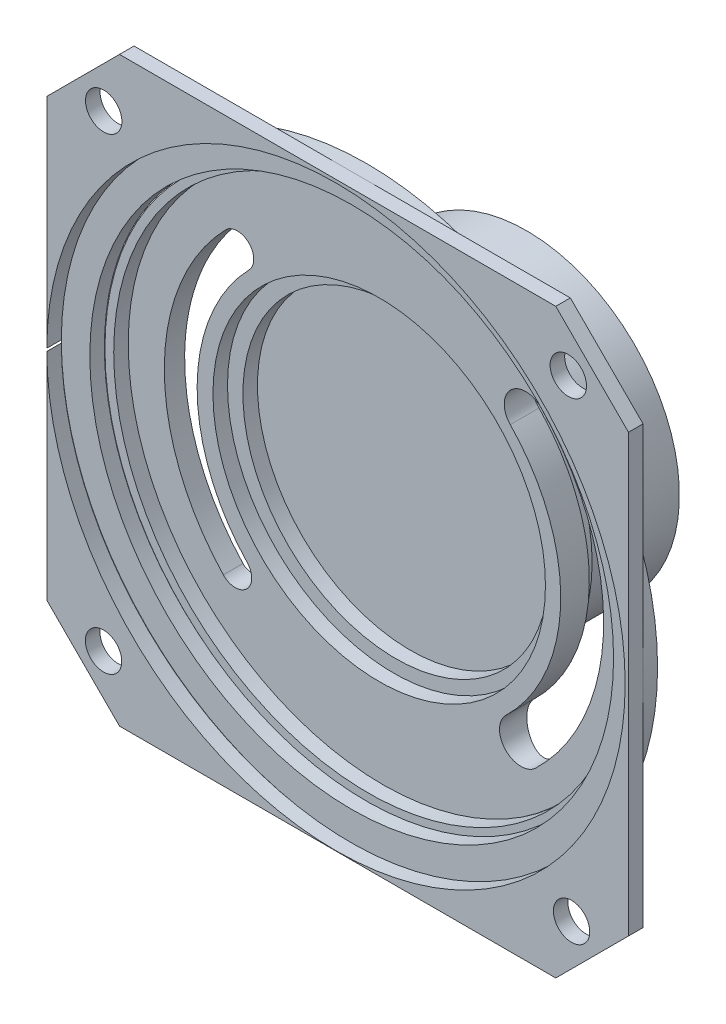
from build123d import *

# Parameters (mm, degrees)
SKETCH9_R            = 20
BOSS_EXTRUDE8_DEPTH  = 1
SKETCH10_R           = 20
BOSS_EXTRUDE9_DEPTH  = 1
SKETCH11_R           = 18
BOSS_EXTRUDE10_DEPTH = 1
SKETCH13_R           = 17.5
BOSS_EXTRUDE11_DEPTH = 2
FILLET2_R            = 10
SKETCH15_R           = 11.5
BOSS_EXTRUDE14_DEPTH = 1
SKETCH16_R           = 10.5
BOSS_EXTRUDE15_DEPTH = 7
SKETCH17_R           = 1.25
CUT_EXTRUDE1_DEPTH   = 7
SKETCH22_R           = 19.885430157
CUT_EXTRUDE4_DEPTH   = 1
SKETCH23_R           = 18.006686429
CUT_EXTRUDE5_DEPTH   = 1
SKETCH24_R           = 17.498830581
CUT_EXTRUDE6_DEPTH   = 1
SKETCH25_R           = 11.431585712
CUT_EXTRUDE7_DEPTH   = 1
CUT_EXTRUDE8_DEPTH   = 3
SKETCH32_R           = 10.520449086
CUT_EXTRUDE10_DEPTH  = 1


with BuildPart() as part:
    # Sketch9 → Boss-Extrude8 (new body)
    with BuildSketch(Plane.XY):
        with BuildLine():
            Line((16.902313625, 8.740359897), (1.902313625, 8.740359897))
            ThreePointArc((1.902313625, 8.740359897), (16.044449248, 2.882495521), (21.902313625, -11.259640103))
            Line((21.902313625, -11.259640103), (21.902313625, 3.740359897))
            Line((21.902313625, 3.740359897), (16.902313625, 8.740359897))
        make_face()
        with BuildLine():
            ThreePointArc((21.902313625, -11.259640103), (16.044449248, -25.401775727), (1.902313625, -31.259640103))
            Line((1.902313625, -31.259640103), (16.902313625, -31.259640103))
            Line((16.902313625, -31.259640103), (21.902313625, -26.259640103))
            Line((21.902313625, -26.259640103), (21.902313625, -11.259640103))
        make_face()
        with Locations((1.902313625, -11.259640103)):
            Circle(SKETCH9_R)
        with BuildLine():
            ThreePointArc((1.902313625, -31.259640103), (-12.239821999, -25.401775727), (-18.097686375, -11.259640103))
            Line((-18.097686375, -11.259640103), (-18.097686375, -26.259640103))
            Line((-18.097686375, -26.259640103), (-13.097686375, -31.259640103))
            Line((-13.097686375, -31.259640103), (1.902313625, -31.259640103))
        make_face()
        with BuildLine():
            Line((-13.097686375, 8.740359897), (-18.097686375, 3.740359897))
            Line((-18.097686375, 3.740359897), (-18.097686375, -11.259640103))
            ThreePointArc((-18.097686375, -11.259640103), (-12.239821999, 2.882495521), (1.902313625, 8.740359897))
            Line((1.902313625, 8.740359897), (-13.097686375, 8.740359897))
        make_face()
    extrude(amount=BOSS_EXTRUDE8_DEPTH)

    # Sketch10 → Boss-Extrude9 (add)
    with BuildSketch(Plane(origin=(0, 0, 0), x_dir=(-1, 0, 0), z_dir=(0, 0, -1))):
        with Locations((-1.902313625, -11.259640103)):
            Circle(SKETCH10_R)
    extrude(amount=BOSS_EXTRUDE9_DEPTH)

    # Sketch11 → Boss-Extrude10 (add)
    with BuildSketch(Plane(origin=(0, 0, -1), x_dir=(-1, 0, 0), z_dir=(0, 0, -1))):
        with Locations((-1.902313625, -11.259640103)):
            Circle(SKETCH11_R)
    extrude(amount=BOSS_EXTRUDE10_DEPTH)

    # Sketch13 → Boss-Extrude11 (add)
    with BuildSketch(Plane(origin=(0, 0, -2), x_dir=(-1, 0, 0), z_dir=(0, 0, -1))):
        with Locations((-1.902313625, -11.259640103)):
            Circle(SKETCH13_R)
    extrude(amount=BOSS_EXTRUDE11_DEPTH)

    # Fillet2
    # the kernel refuses this fillet: 10 mm, written as the material it takes off along each edge
    with BuildSketch(Plane(origin=(1.902313625, -11.259640103, -4), x_dir=(-1, 0, 0), z_dir=(0, -1, 0))) as fillet2_piece_1:
        with BuildLine():
            CenterArc((11.5, -10), FILLET2_R, 53.130102354, 36.869897646)
            Line((11.5, 0), (11.5, 0.2))
            Line((11.5, 0.2), (17.5, 0.2))
            Line((17.5, 0.2), (17.7, 0))
            ThreePointArc((17.7, 0), (17.7, -1), (17.62, -1.84))
            Line((17.62, -1.84), (17.5, -2))
        make_face()
    revolve(axis=Axis((1.902313625, -11.259640103, -4), (0, 0, -1)), mode=Mode.SUBTRACT)

    # Sketch15 → Boss-Extrude14 (add)
    with BuildSketch(Plane(origin=(0, 0, -4), x_dir=(-1, 0, 0), z_dir=(0, 0, -1))):
        with Locations((-1.902313625, -11.259640103)):
            Circle(SKETCH15_R)
    extrude(amount=BOSS_EXTRUDE14_DEPTH)

    # Sketch16 → Boss-Extrude15 (add)
    with BuildSketch(Plane(origin=(0, 0, -5), x_dir=(-1, 0, 0), z_dir=(0, 0, -1))):
        with Locations((-1.902313625, -11.259640103)):
            Circle(SKETCH16_R)
    extrude(amount=BOSS_EXTRUDE15_DEPTH)

    # Sketch17 → Cut-Extrude1 (cut)
    with BuildSketch(Plane(origin=(0, 0, 0), x_dir=(-1, 0, 0), z_dir=(0, 0, -1))):
        with Locations((-17.988100062, -27.34542654)):
            Circle(SKETCH17_R)
        with Locations((-17.763809056, 5.050437341)):
            Circle(SKETCH17_R)
        with Locations((14.183472813, 4.826146335)):
            Circle(SKETCH17_R)
        with Locations((14.192917147, -27.335982207)):
            Circle(SKETCH17_R)
    extrude(amount=-CUT_EXTRUDE1_DEPTH, mode=Mode.SUBTRACT)

    # Sketch22 → Cut-Extrude4 (cut)
    with BuildSketch(Plane.XY.offset(1)):
        with Locations((1.787515975, -11.354824182)):
            Circle(SKETCH22_R)
    extrude(amount=-CUT_EXTRUDE4_DEPTH, mode=Mode.SUBTRACT)

    # Sketch23 → Cut-Extrude5 (cut)
    with BuildSketch(Plane.XY):
        with Locations((1.870004869, -11.231695531)):
            Circle(SKETCH23_R)
    extrude(amount=-CUT_EXTRUDE5_DEPTH, mode=Mode.SUBTRACT)

    # Sketch24 → Cut-Extrude6 (cut)
    with BuildSketch(Plane.XY.offset(-1)):
        with Locations((2.003621261, -11.194132882)):
            Circle(SKETCH24_R)
    extrude(amount=-CUT_EXTRUDE6_DEPTH, mode=Mode.SUBTRACT)

    # Sketch25 → Cut-Extrude7 (cut)
    with BuildSketch(Plane.XY.offset(-2)):
        with Locations((1.760347749, -11.251117152)):
            Circle(SKETCH25_R)
    extrude(amount=-CUT_EXTRUDE7_DEPTH, mode=Mode.SUBTRACT)

    # Sketch31 → Cut-Extrude8 (cut)
    with BuildSketch(Plane.XY.offset(-2)):
        with BuildLine():
            ThreePointArc((-8.801904408, -1.059495183), (-13.015152024, -11.339263863), (-8.954990434, -21.680452743))
            ThreePointArc((-8.954990434, -21.680452743), (-7.360251179, -21.727858352), (-7.312845569, -20.133119097))
            ThreePointArc((-7.312845569, -20.133119097), (-10.758916086, -11.356013725), (-7.182913489, -2.631038874))
            ThreePointArc((-7.182913489, -2.631038874), (-7.206637103, -1.035771569), (-8.801904408, -1.059495183))
        make_face()
        with BuildLine():
            ThreePointArc((12.532818581, -22.441763104), (17.191560153, -11.705450505), (12.894068467, -0.819503305))
            ThreePointArc((12.894068467, -0.819503305), (10.807683124, -0.784645409), (10.772825228, -2.871030753))
            ThreePointArc((10.772825228, -2.871030753), (14.240965704, -11.656153997), (10.481291133, -20.320519865))
            ThreePointArc((10.481291133, -20.320519865), (10.446433238, -22.406905208), (12.532818581, -22.441763104))
        make_face()
    extrude(amount=-CUT_EXTRUDE8_DEPTH, mode=Mode.SUBTRACT)

    # Sketch32 → Cut-Extrude10 (cut)
    with BuildSketch(Plane.XY.offset(-3)):
        with Locations((1.909022751, -11.226091394)):
            Circle(SKETCH32_R)
    extrude(amount=-CUT_EXTRUDE10_DEPTH, mode=Mode.SUBTRACT)


solid = part.part
